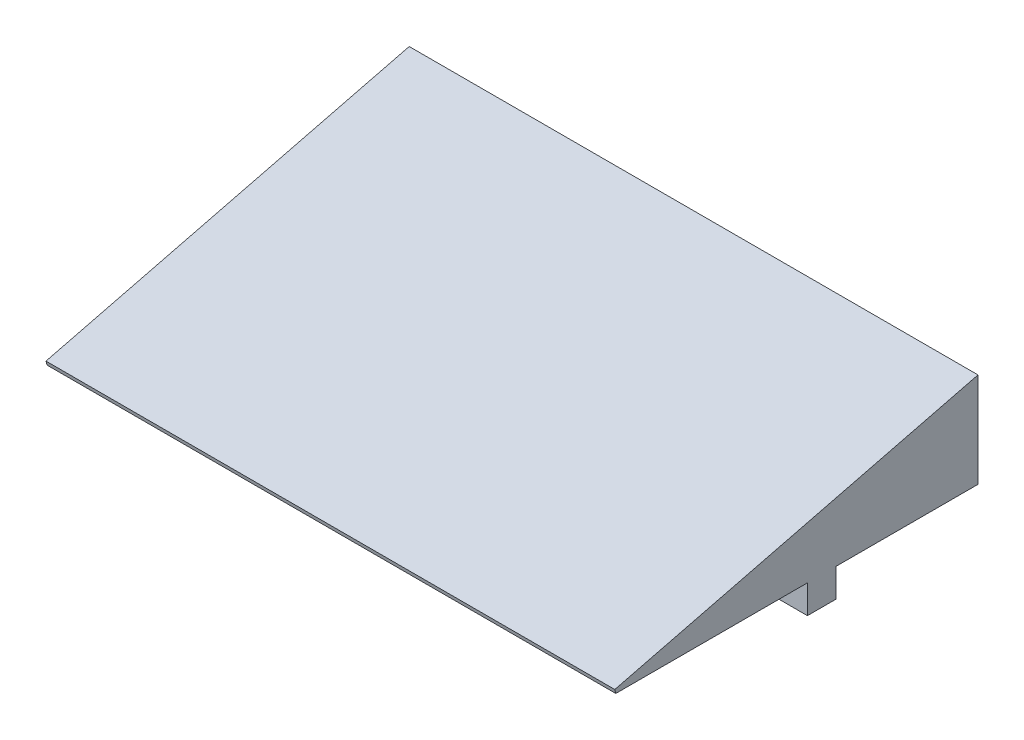
from build123d import *

# Parameters (mm, degrees)
SKETCH3_W               = 120
SKETCH3_H               = 80
BOSS_EXTRUDE1_DEPTH     = 19.999999878
CUT_EXTRUDE3_DEPTH      = 129.06248473
CUT_EXTRUDE3_DEPTH_BACK = 120
SKETCH5_W               = 6
SKETCH5_H               = 6
BOSS_EXTRUDE2_DEPTH     = 120
SKETCH6_W               = 120
SKETCH6_H               = 3.448417243
CUT_EXTRUDE4_DEPTH      = 10


with BuildPart() as part:
    # Sketch3 → Boss-Extrude1 (new body)
    with BuildSketch(Plane(origin=(0, 0, 0), x_dir=(1, 0, 0), z_dir=(0, 1, 0))):
        Rectangle(SKETCH3_W, SKETCH3_H)
    extrude(amount=BOSS_EXTRUDE1_DEPTH)

    # Sketch4 → Cut-Extrude3 (cut, two sides: drawn at the far end of the back side and taken through both)
    with BuildSketch(Plane(origin=(60, 0, 0), x_dir=(0, 0, -1), z_dir=(1, 0, 0)).offset(-CUT_EXTRUDE3_DEPTH_BACK)):
        Polygon((-40, 19.999999878), (-40, 0), (-39.971354525, 0), (40, 19.999999878), align=None)
    extrude(amount=CUT_EXTRUDE3_DEPTH + CUT_EXTRUDE3_DEPTH_BACK, mode=Mode.SUBTRACT)

    # Sketch5 → Boss-Extrude2 (add)
    with BuildSketch(Plane(origin=(60, 0, 0), x_dir=(0, 0, -1), z_dir=(1, 0, 0))):
        with Locations((7.014322738, -3)):
            Rectangle(SKETCH5_W, SKETCH5_H)
    extrude(amount=-BOSS_EXTRUDE2_DEPTH)

    # Sketch6 → Cut-Extrude4 (cut)
    with BuildSketch(Plane(origin=(0, 9.407996861, 2.352841679), x_dir=(1, 0, 0), z_dir=(0, 0.9701220561939727, 0.2426173861988841))):
        with Locations((0, -37.052884019)):
            Rectangle(SKETCH6_W, SKETCH6_H)
    extrude(amount=-CUT_EXTRUDE4_DEPTH, mode=Mode.SUBTRACT)


solid = part.part
